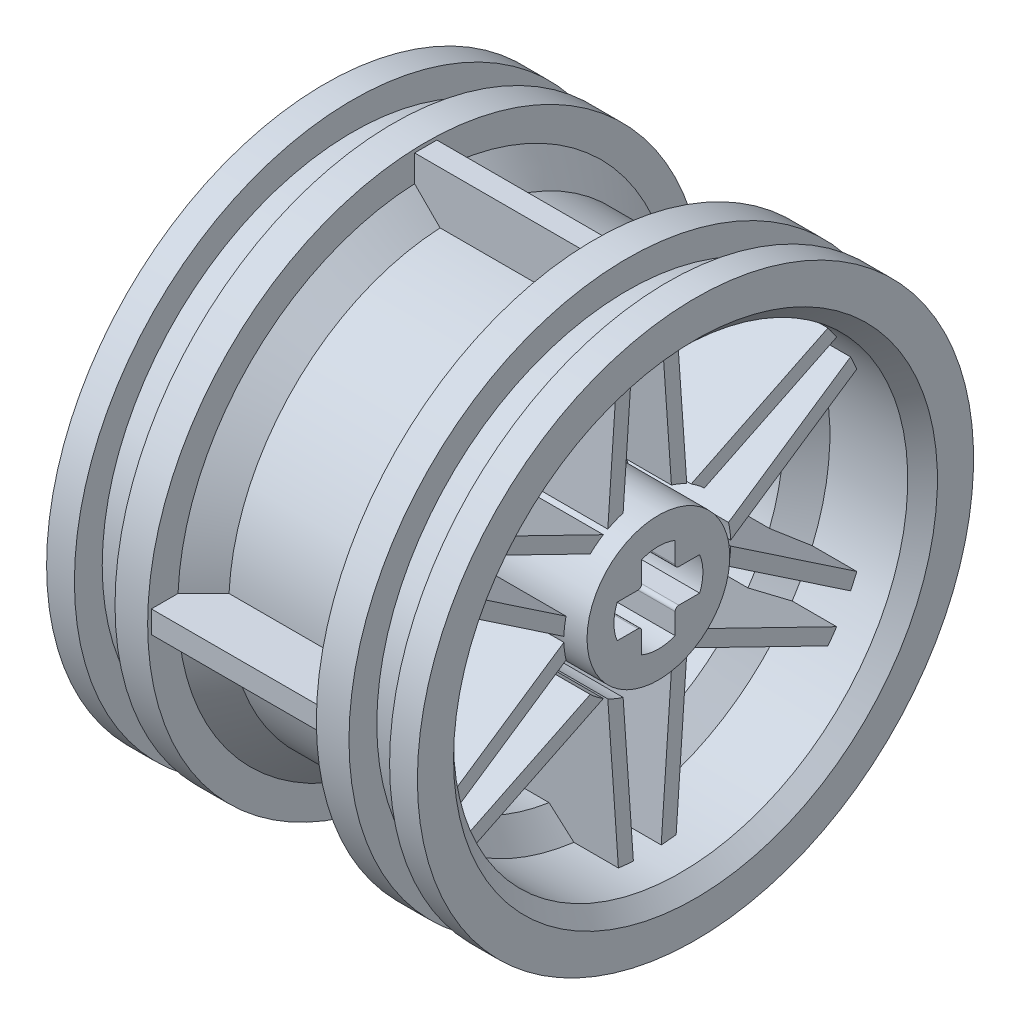
from build123d import *

# Parameters (mm, degrees)
BOSS_EXTRUDE1_REACH = 27.091
SKETCH3_R           = 1.45
SKETCH4_R           = 0.6
SKETCH4_R_2         = 1
CUT_EXTRUDE1_DEPTH  = 0.2
CUT_EXTRUDE2_REACH  = 29.821
SKETCH6_R           = 1.5
CUT_EXTRUDE3_DEPTH  = 30.154759474
RIB1_REACH          = 25.452
SKETCH7_WALL_W      = 58.004157598
SKETCH7_WALL_H      = 1.2
CIRPATTERN1_COUNT   = 4
BOSS_EXTRUDE2_REACH = 33.755
BOSS_EXTRUDE2_START = -2.6
CIRPATTERN2_COUNT   = 6
CHAMFER1_SIZE       = 0.8


with BuildPart() as part:
    # Sketch1 → Revolve1 (revolve)
    with BuildSketch(Plane.XY):
        Polygon((10, 12.25), (10, 15), (8.5, 15), (8.5, 13.5), (6.31, 13.5), (6.31, 15), (4.55, 15), (4.55, 13.375), (3.175, 12), (-3.175, 12), (-4.55, 13.375), (-4.55, 15), (-6.31, 15), (-6.31, 13.5), (-8.5, 13.5), (-8.5, 15), (-10, 15), (-10, 12.25), (-5, 12.25), (-3.75, 11), (3.75, 11), (5, 12.25), align=None)
    revolve(axis=Axis((0, 0, 0), (1, 0, 0)))

    # Sketch2 → Revolve3 (revolve)
    with BuildSketch(Plane.XY):
        Polygon((1, 11), (2.37, 11), (0.5, 5.1), (0.5, 4.5), (2, 4.5), (2, 3.85), (8, 3.85), (8, 0), (0.6, 0), (0.6, 3.804964539), (-3.4, 3.804964539), (-3.4, 5.8), (-0.648135593, 5.8), align=None)
    revolve(axis=Axis((0, 0, 0), (1, 0, 0)))

    # Sketch3 → Boss-Extrude1 (add, up to next)
    with BuildSketch(Plane.ZY.offset(3.4), mode=Mode.PRIVATE) as boss_extrude1_sk1:
        with Locations((0, -6)):
            Circle(SKETCH3_R)
    boss_extrude1_tool1 = extrude(boss_extrude1_sk1.sketch, amount=-BOSS_EXTRUDE1_REACH, mode=Mode.PRIVATE) - part.part
    add(boss_extrude1_tool1.solids().sort_by_distance((-3.4, -6, 0))[0])

    # Sketch4 → Cut-Extrude1 (cut)
    with BuildSketch(Plane.ZY.offset(3.4)):
        with Locations((0, 4.75)):
            Circle(SKETCH4_R)
        with Locations((2.802423475, 3.835221332)):
            Circle(SKETCH4_R)
        with Locations((4.525437597, 1.443230596)):
            Circle(SKETCH4_R)
        with Locations((4.505389076, -1.504649219)):
            Circle(SKETCH4_R)
        with Locations((2.75, -3.872983346)):
            Circle(SKETCH4_R)
        with Locations((-2.75, -3.872983346)):
            Circle(SKETCH4_R)
        with Locations((-4.505389076, -1.504649219)):
            Circle(SKETCH4_R)
        with Locations((-2.802423475, 3.835221332)):
            Circle(SKETCH4_R)
        with Locations((-4.525437597, 1.443230596)):
            Circle(SKETCH4_R)
        with Locations((0, -6)):
            Circle(SKETCH4_R_2)
    extrude(amount=-CUT_EXTRUDE1_DEPTH, mode=Mode.SUBTRACT)

    # Sketch5 → Cut-Extrude2 (cut, up to next)
    with BuildSketch(Plane(origin=(8, 0, 0), x_dir=(0, 0, -1), z_dir=(1, 0, 0)), mode=Mode.PRIVATE) as cut_extrude2_sk1:
        with BuildLine():
            Line((0.9, 1.1), (0.9, 2.224859546))
            ThreePointArc((0.9, 2.224859546), (0, 2.4), (-0.9, 2.224859546))
            Line((-0.9, 2.224859546), (-0.9, 1.1))
            ThreePointArc((-0.9, 1.1), (-0.958578644, 0.958578644), (-1.1, 0.9))
            Line((-1.1, 0.9), (-2.224859546, 0.9))
            ThreePointArc((-2.224859546, 0.9), (-2.4, 0), (-2.224859546, -0.9))
            Line((-2.224859546, -0.9), (-1.1, -0.9))
            ThreePointArc((-1.1, -0.9), (-0.958578644, -0.958578644), (-0.9, -1.1))
            Line((-0.9, -1.1), (-0.9, -2.224859546))
            ThreePointArc((-0.9, -2.224859546), (0, -2.4), (0.9, -2.224859546))
            Line((0.9, -2.224859546), (0.9, -1.1))
            ThreePointArc((0.9, -1.1), (0.958578644, -0.958578644), (1.1, -0.9))
            Line((1.1, -0.9), (2.224859546, -0.9))
            ThreePointArc((2.224859546, -0.9), (2.4, 0), (2.224859546, 0.9))
            Line((2.224859546, 0.9), (1.1, 0.9))
            ThreePointArc((1.1, 0.9), (0.958578644, 0.958578644), (0.9, 1.1))
        make_face()
    cut_extrude2_tool1 = extrude(cut_extrude2_sk1.sketch, amount=-CUT_EXTRUDE2_REACH, mode=Mode.PRIVATE) & part.part
    add(cut_extrude2_tool1.solids().sort_by_distance((8, 0, 0))[0], mode=Mode.SUBTRACT)

    # Sketch6 → Cut-Extrude3 (cut, through all)
    with BuildSketch(Plane(origin=(10, 0, 0), x_dir=(0, 0, -1), z_dir=(1, 0, 0))):
        with Locations((4, 6.92820323)):
            Circle(SKETCH6_R)
        with Locations((8, 0)):
            Circle(SKETCH6_R)
        with Locations((4, -6.92820323)):
            Circle(SKETCH6_R)
        with Locations((-4, -6.92820323)):
            Circle(SKETCH6_R)
        with Locations((-8, 0)):
            Circle(SKETCH6_R)
        with Locations((-4, 6.92820323)):
            Circle(SKETCH6_R)
    extrude(amount=-CUT_EXTRUDE3_DEPTH, mode=Mode.SUBTRACT)

    # Sketch7 wall → Rib1 (add, up to next)
    with BuildSketch(Plane(origin=(0, 14.8, 0), x_dir=(-1, 0, 0), z_dir=(0, -1, 0)), mode=Mode.PRIVATE) as rib1_sk1:
        Rectangle(SKETCH7_WALL_W, SKETCH7_WALL_H)
    rib1_tool1 = extrude(rib1_sk1.sketch, amount=RIB1_REACH, mode=Mode.PRIVATE) - part.part
    rib1 = rib1_tool1.solids().sort_by_distance((0, 14.8, 0))[0]
    add(rib1)

    # CirPattern1: Rib1 ×4 about axis
    cirpattern1_axis = Axis((0, 0, 0), (-1, 0, 0))
    for i in range(1, CIRPATTERN1_COUNT):
        add(rib1.rotate(cirpattern1_axis, i * 360 / CIRPATTERN1_COUNT))

    # Sketch8 → Boss-Extrude2 (add, up to next)
    with BuildSketch(Plane(origin=(10, 0, 0), x_dir=(0, 0, -1), z_dir=(1, 0, 0)).offset(BOSS_EXTRUDE2_START), mode=Mode.PRIVATE) as boss_extrude2_sk1:
        with BuildLine():
            Line((1.55728457, 12.150611703), (2.128975364, 3.964525684))
            ThreePointArc((2.128975364, 3.964525684), (1.724567752, 4.156424674), (1.303095799, 4.307196459))
            Line((1.303095799, 4.307196459), (0.75, 12.227019261))
            ThreePointArc((0.75, 12.227019261), (1.154274686, 12.195497118), (1.55728457, 12.150611703))
        make_face()
    boss_extrude2_tool1 = extrude(boss_extrude2_sk1.sketch, amount=-BOSS_EXTRUDE2_REACH, mode=Mode.PRIVATE) - part.part
    # Sketch8 → Boss-Extrude2 (add, up to next)
    with BuildSketch(Plane(origin=(10, 0, 0), x_dir=(0, 0, -1), z_dir=(1, 0, 0)).offset(BOSS_EXTRUDE2_START), mode=Mode.PRIVATE) as boss_extrude2_sk2:
        with BuildLine():
            Line((-1.303095799, 4.307196459), (-0.75, 12.227019261))
            ThreePointArc((-0.75, 12.227019261), (-1.154274686, 12.195497118), (-1.55728457, 12.150611703))
            Line((-1.55728457, 12.150611703), (-2.128975364, 3.964525684))
            ThreePointArc((-2.128975364, 3.964525684), (-1.724567752, 4.156424674), (-1.303095799, 4.307196459))
        make_face()
    boss_extrude2_tool2 = extrude(boss_extrude2_sk2.sketch, amount=-BOSS_EXTRUDE2_REACH, mode=Mode.PRIVATE) - part.part
    boss_extrude2_1 = boss_extrude2_tool1.solids().sort_by_distance((7.4, 8.172301, -1.436348))[0]
    add(boss_extrude2_1)
    boss_extrude2_2 = boss_extrude2_tool2.solids().sort_by_distance((7.4, 8.172301, 1.436348))[0]
    add(boss_extrude2_2)
    boss_extrude2 = boss_extrude2_1 + boss_extrude2_2  # Boss-Extrude2 as one shape, for the pattern or mirror that repeats it

    # CirPattern2: Boss-Extrude2 ×6 about axis
    cirpattern2_axis = Axis((0, 0, 0), (-1, 0, 0))
    for i in range(1, CIRPATTERN2_COUNT):
        add(boss_extrude2.rotate(cirpattern2_axis, i * 360 / CIRPATTERN2_COUNT))

    # Chamfer1
    chamfer1_edges = [part.edges().sort_by_distance(p)[0] for p in [
        (-10, -12.25, 0),
        (10, -12.25, 0),
    ]]
    chamfer(chamfer1_edges, length=CHAMFER1_SIZE)


solid = part.part
